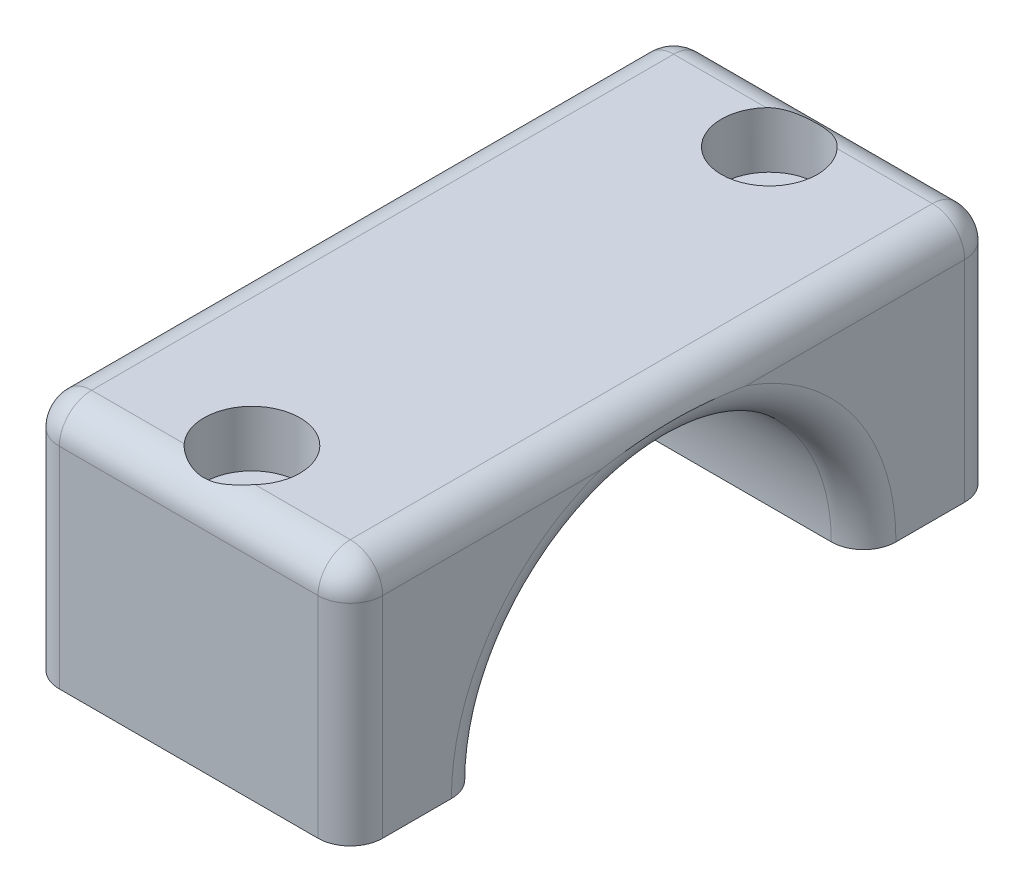
from build123d import *

# Parameters (mm, degrees)
SKETCH1_W                                      = 50.8
SKETCH1_H                                      = 19.05
BOSS_EXTRUDE1_DEPTH                            = 25.4
SKETCH2_R                                      = 14.9225
CUT_EXTRUDE1_DEPTH                             = 60.905780189
CBORE_FOR_6_BUTTON_HEAD_CAP_SCREW1_D           = 4.3053
CBORE_FOR_6_BUTTON_HEAD_CAP_SCREW1_CBORE_D     = 7.54126
CBORE_FOR_6_BUTTON_HEAD_CAP_SCREW1_CBORE_DEPTH = 4.3942
FILLET1_R                                      = 2.54


with BuildPart() as part:
    # Sketch1 → Boss-Extrude1 (new body)
    with BuildSketch(Plane(origin=(0, 0, 0), x_dir=(0, 0, -1), z_dir=(1, 0, 0))):
        with Locations((25.4, 9.525)):
            Rectangle(SKETCH1_W, SKETCH1_H)
    extrude(amount=BOSS_EXTRUDE1_DEPTH)

    # Sketch2 → Cut-Extrude1 (cut, through all)
    with BuildSketch(Plane(origin=(25.4, 0, 0), x_dir=(0, 0, -1), z_dir=(1, 0, 0))):
        with Locations((25.4, 0)):
            Circle(SKETCH2_R)
    extrude(amount=-CUT_EXTRUDE1_DEPTH, mode=Mode.SUBTRACT)

    # CBORE for #6 Button Head Cap Screw1 (through all)
    with Locations(Plane(origin=(0, 19.05, 0), x_dir=(1, 0, 0), z_dir=(0, 1, 0))):
        with Locations((12.594620829, 5.08), (12.594620829, 45.72)):
            CounterBoreHole(CBORE_FOR_6_BUTTON_HEAD_CAP_SCREW1_D / 2, CBORE_FOR_6_BUTTON_HEAD_CAP_SCREW1_CBORE_D / 2, CBORE_FOR_6_BUTTON_HEAD_CAP_SCREW1_CBORE_DEPTH)

    # Fillet1
    # the kernel refuses this fillet: 2.54 mm, written as the material it takes off along each edge
    with BuildSketch(Plane(origin=(22.86, 16.51, -48.26), x_dir=(0, 1, 0), z_dir=(1, 0, 0))) as fillet1_piece_1_section:
        Polygon((0, 0), (FILLET1_R, 0), (FILLET1_R, -FILLET1_R), (0, -FILLET1_R), align=None)
    fillet1_piece_1 = extrude(amount=FILLET1_R, mode=Mode.PRIVATE)
    fillet1_piece_1 = fillet1_piece_1 - Plane(origin=(22.86, 16.51, -48.26), x_dir=(0, -0.7071067811865475, 0.7071067811865475), z_dir=(1, 0, 0)) * Sphere(FILLET1_R, mode=Mode.PRIVATE)
    add(fillet1_piece_1, mode=Mode.SUBTRACT)
    with BuildSketch(Plane(origin=(22.86, 16.51, -2.54), x_dir=(1, 0, 0), z_dir=(0, 0, 1))) as fillet1_piece_2_section:
        Polygon((0, 0), (FILLET1_R, 0), (FILLET1_R, FILLET1_R), (0, FILLET1_R), align=None)
    fillet1_piece_2 = extrude(amount=FILLET1_R, mode=Mode.PRIVATE)
    fillet1_piece_2 = fillet1_piece_2 - Plane(origin=(22.86, 16.51, -2.54), x_dir=(-0.7071067811865475, -0.7071067811865475, 0), z_dir=(0, 0, 1)) * Sphere(FILLET1_R, mode=Mode.PRIVATE)
    add(fillet1_piece_2, mode=Mode.SUBTRACT)
    with BuildSketch(Plane(origin=(2.54, 16.51, -48.26), x_dir=(0, 1, 0), z_dir=(-1, 0, 0))) as fillet1_piece_3_section:
        Polygon((0, 0), (FILLET1_R, 0), (FILLET1_R, FILLET1_R), (0, FILLET1_R), align=None)
    fillet1_piece_3 = extrude(amount=FILLET1_R, mode=Mode.PRIVATE)
    fillet1_piece_3 = fillet1_piece_3 - Plane(origin=(2.54, 16.51, -48.26), x_dir=(0, -0.7071067811865475, 0.7071067811865475), z_dir=(-1, 0, 0)) * Sphere(FILLET1_R, mode=Mode.PRIVATE)
    add(fillet1_piece_3, mode=Mode.SUBTRACT)
    with BuildSketch(Plane(origin=(2.54, 16.51, -2.54), x_dir=(0, 0, 1), z_dir=(-1, 0, 0))) as fillet1_piece_4_section:
        Polygon((0, 0), (FILLET1_R, 0), (FILLET1_R, FILLET1_R), (0, FILLET1_R), align=None)
    fillet1_piece_4 = extrude(amount=FILLET1_R, mode=Mode.PRIVATE)
    fillet1_piece_4 = fillet1_piece_4 - Plane(origin=(2.54, 16.51, -2.54), x_dir=(0, -0.7071067811865475, -0.7071067811865475), z_dir=(-1, 0, 0)) * Sphere(FILLET1_R, mode=Mode.PRIVATE)
    add(fillet1_piece_4, mode=Mode.SUBTRACT)
    with BuildSketch(Plane(origin=(25.4, -6.35, -50.8), x_dir=(0, 0, 1), z_dir=(0, 1, 0))) as fillet1_piece_5:
        with BuildLine():
            CenterArc((FILLET1_R, -FILLET1_R), FILLET1_R, 90, 90)
            Line((0, -FILLET1_R), (0, 0))
            Line((0, 0), (FILLET1_R, 0))
        make_face()
    extrude(amount=22.86, mode=Mode.SUBTRACT)
    with BuildSketch(Plane(origin=(25.4, 19.05, -48.26), x_dir=(0, -1, 0), z_dir=(0, 0, 1))) as fillet1_piece_6:
        with BuildLine():
            CenterArc((FILLET1_R, -FILLET1_R), FILLET1_R, 90, 90)
            Line((0, -FILLET1_R), (0, 0))
            Line((0, 0), (FILLET1_R, 0))
        make_face()
    extrude(amount=45.72, mode=Mode.SUBTRACT)
    with BuildSketch(Plane(origin=(25.4, 0, -25.4), x_dir=(0, -0.413428527977308, -0.9105365738148667), z_dir=(0, -0.9105365738148667, 0.413428527977308))) as fillet1_piece_7:
        with BuildLine():
            CenterArc((14.9225 + FILLET1_R, -FILLET1_R), FILLET1_R, 90, 90)
            Line((14.9225 + FILLET1_R, 0), (14.9225, 0))
            Line((14.9225, 0), (14.9225, -FILLET1_R))
        make_face()
    revolve(axis=Axis((25.4, 0, -25.4), (1, 0, 0)), revolution_arc=228.840784647, mode=Mode.SUBTRACT)
    with BuildSketch(Plane(origin=(0, 0, -25.4), x_dir=(0, -0.413428527977308, -0.9105365738148667), z_dir=(0, -0.9105365738148667, 0.413428527977308))) as fillet1_piece_8:
        with BuildLine():
            CenterArc((14.9225 + FILLET1_R, FILLET1_R), FILLET1_R, 180, 90)
            Line((14.9225, FILLET1_R), (14.9225, 0))
            Line((14.9225, 0), (14.9225 + FILLET1_R, 0))
        make_face()
    revolve(axis=Axis((0, 0, -25.4), (1, 0, 0)), revolution_arc=228.840784647, mode=Mode.SUBTRACT)
    with BuildSketch(Plane(origin=(25.4, 16.51, 0), x_dir=(-1, 0, 0), z_dir=(0, -1, 0)), Plane(origin=(0, -6.35, -50.8), x_dir=(0, 0, 1), z_dir=(0, 1, 0)), Plane(origin=(0, 16.51, 0), x_dir=(0, 0, -1), z_dir=(0, -1, 0))) as fillet1_piece_9:
        with BuildLine():
            CenterArc((FILLET1_R, FILLET1_R), FILLET1_R, 180, 90)
            Line((0, FILLET1_R), (0, 0))
            Line((0, 0), (FILLET1_R, 0))
        make_face()
    extrude(amount=22.86, mode=Mode.SUBTRACT)
    with BuildSketch(Plane(origin=(0, 19.05, -48.26), x_dir=(0, -1, 0), z_dir=(0, 0, 1))) as fillet1_piece_10:
        with BuildLine():
            CenterArc((FILLET1_R, FILLET1_R), FILLET1_R, 180, 90)
            Line((0, FILLET1_R), (0, 0))
            Line((0, 0), (FILLET1_R, 0))
        make_face()
    extrude(amount=45.72, mode=Mode.SUBTRACT)
    with BuildSketch(Plane(origin=(2.54, 19.05, 0), x_dir=(0, -1, 0), z_dir=(1, 0, 0)), Plane(origin=(2.54, 19.05, -50.8), x_dir=(0, 0, 1), z_dir=(1, 0, 0))) as fillet1_piece_11:
        with BuildLine():
            CenterArc((FILLET1_R, FILLET1_R), FILLET1_R, 180, 90)
            Line((0, FILLET1_R), (0, 0))
            Line((0, 0), (FILLET1_R, 0))
        make_face()
    extrude(amount=20.32, mode=Mode.SUBTRACT)


solid = part.part
